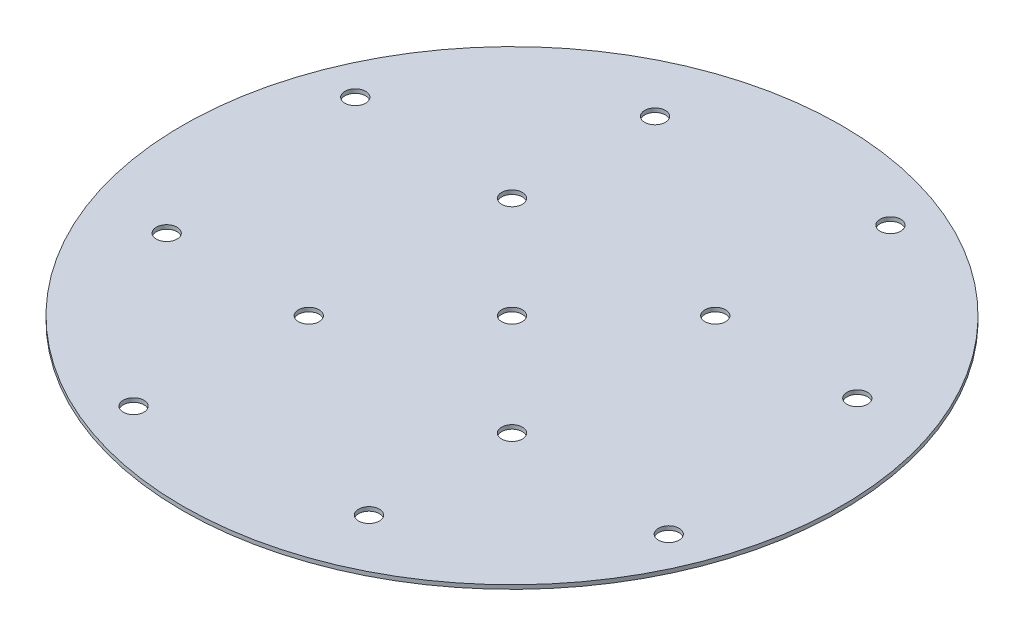
from build123d import *

# Parameters (mm, degrees)
SKETCH2_W                  = 82.55
SKETCH2_H                  = 1
F_6_0_204_DIAMETER_HOLE1_D = 5.1816
CIRPATTERN3_COUNT          = 4
F_6_0_204_DIAMETER_HOLE2_D = 5.1816


with BuildPart() as part:
    # Sketch2 → Revolve1 (revolve)
    with BuildSketch(Plane(origin=(0, 0, 0), x_dir=(0, 0, -1), z_dir=(1, 0, 0))):
        with Locations((-41.275, 0.5)):
            Rectangle(SKETCH2_W, SKETCH2_H)
    revolve(axis=Axis((0, -0.05, 0), (0, 1, 0)))

    # #6 (0.204) Diameter Hole1 (through all)
    with Locations(Plane(origin=(0, 1, 0), x_dir=(1, 0, 0), z_dir=(0, 1, 0))):
        with Locations((-25.333643223, 61.160825052), (264.743675233, 73.787758551), (-67.027460084, 27.763683018), (-25.455844123, 25.455844123)):
            f_6_0_204_diameter_hole1 = Hole(F_6_0_204_DIAMETER_HOLE1_D / 2)

    # CirPattern3: #6 (0.204) Diameter Hole1 ×4 about axis
    cirpattern3_axis = Axis((0, -0.05, 0), (0, 1, 0))
    for i in range(1, CIRPATTERN3_COUNT):
        add(f_6_0_204_diameter_hole1.rotate(cirpattern3_axis, i * 360 / CIRPATTERN3_COUNT), mode=Mode.SUBTRACT)

    # #6 (0.204) Diameter Hole2 (through all)
    with Locations(Plane(origin=(0, 1, 0), x_dir=(1, 0, 0), z_dir=(0, 1, 0))):
        with Locations((0, 0)):
            Hole(F_6_0_204_DIAMETER_HOLE2_D / 2)


solid = part.part
